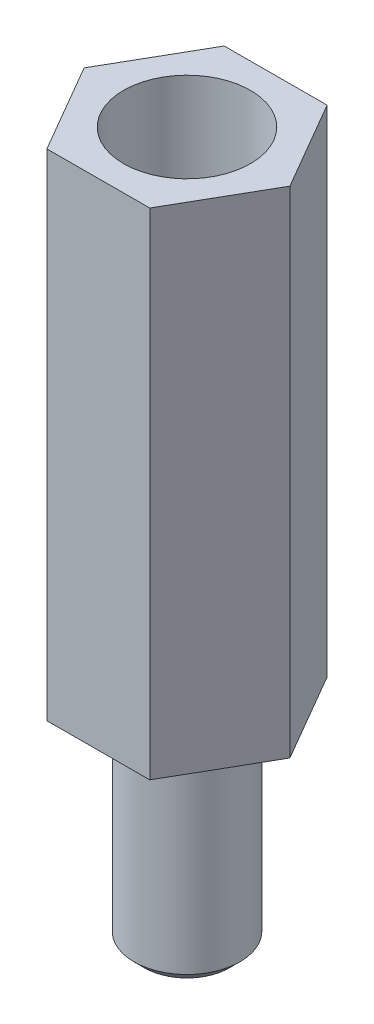
from build123d import *

# Parameters (mm, degrees)
EXTRUDE_1_DEPTH     = 11.7
SKETCH_2_R          = 1.5
CUT_EXTRUDE_1_DEPTH = 10
SKETCH_3_R          = 1.5
EXTRUDE_2_DEPTH     = 5


# Read off the part's stored shape, not the designer's step: M2.5 机械螺纹 螺柱1
with BuildPart() as part:
    # 草图1 → 凸台-拉伸1 (new body)
    with BuildSketch(Plane(origin=(0, 0, 0), x_dir=(1, 0, 0), z_dir=(0, 1, 0))):
        Polygon((-1.21761392, 2.097001751), (-2.424863748, -0.005983711), (-1.207249828, -2.102985462), (1.21761392, -2.097001751), (2.424863748, 0.005983711), (1.207249828, 2.102985462), align=None)
    extrude(amount=EXTRUDE_1_DEPTH)

    # 草图2 → 切除-拉伸1 (cut)
    with BuildSketch(Plane(origin=(0, 11.7, 0), x_dir=(1, 0, 0), z_dir=(0, 1, 0))):
        with Locations(Location((0, 0, 0), (0, 0, 270))):
            Circle(SKETCH_2_R)
    extrude(amount=-CUT_EXTRUDE_1_DEPTH, mode=Mode.SUBTRACT)

    # 草图3 → 凸台-拉伸2 (add)
    with BuildSketch(Plane.XZ):
        with Locations(Location((0, 0, 0), (0, 0, 90))):
            Circle(SKETCH_3_R)
    extrude(amount=EXTRUDE_2_DEPTH)

    # M2.5 机械螺纹 螺柱1 outline → M2.5 机械螺纹 螺柱1 (revolve, cut)
    with BuildSketch(Plane.XY):
        Polygon((1.5, 0), (1.25, 0), (1.25, -4.7565), (1.0065, -5), (1.5, -5), align=None)
    revolve(axis=Axis((0, 0, 0), (0, 1, 0)), mode=Mode.SUBTRACT)


solid = part.part
